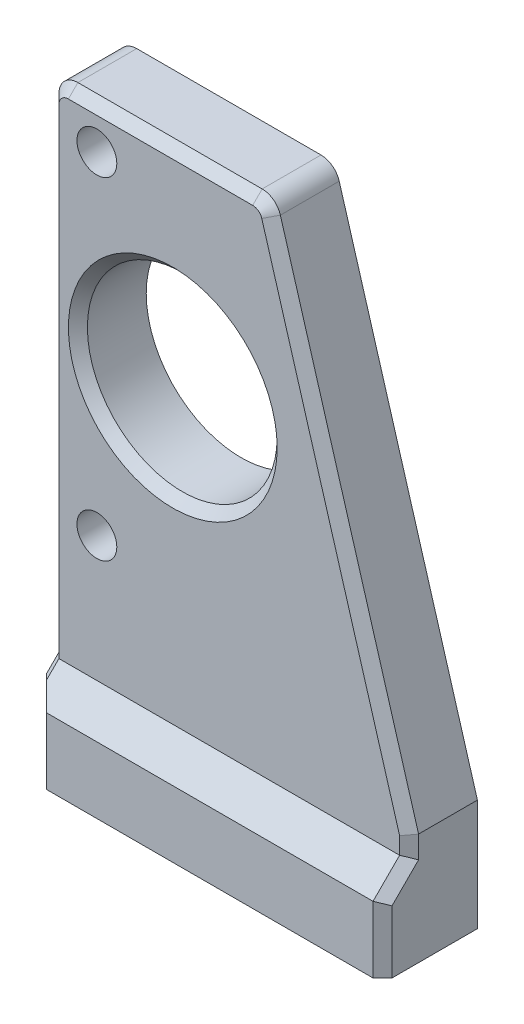
from build123d import *

# Parameters (mm, degrees)
SKIZZE1_R                            = 2.1
AUFSATZ_LINEAR_AUSTRAGEN1_DEPTH      = 10
SKIZZE2_R                            = 1.5
SCHNITT_LINEAR_AUSTRAGEN1_DEPTH      = 8
SCHNITT_LINEAR_AUSTRAGEN3_DEPTH      = 2.8
SCHNITT_LINEAR_AUSTRAGEN5_DEPTH      = 69.862823313
SCHNITT_LINEAR_AUSTRAGEN5_DEPTH_BACK = 69.862823313
SKIZZE7_R                            = 10
FASE1_SIZE                           = 3
SCHNITT_LINEAR_AUSTRAGEN4_DEPTH      = 10
VERRUNDUNG1_R                        = 2
FASE2_SIZE                           = 1
FASE3_SIZE                           = 2.5
SKIZZE8_R                            = 3.6
SCHNITT_LINEAR_AUSTRAGEN6_DEPTH      = 3


with BuildPart() as part:
    # Skizze1 → Aufsatz-Linear austragen1 (new body)
    with BuildSketch(Plane.XY):
        Polygon((28.287001282, 57.370618027), (28.287001282, 0), (-13.088781156, 0), (-13.088781156, 27.348243657), (-13.088781156, 53.715647777), (-13.088781156, 57.370618027), (-13.088781156, 62.370618027), (28.287001282, 62.370618027), align=None)
        with Locations((-8.088781156, 23.031945717)):
            Circle(SKIZZE1_R, mode=Mode.SUBTRACT)
        with Locations(Location((-8.088781156, 58.031945717, 0), (0, 0, 180))):
            Circle(SKIZZE1_R, mode=Mode.SUBTRACT)
    extrude(amount=AUFSATZ_LINEAR_AUSTRAGEN1_DEPTH)

    # Skizze2 → Schnitt-Linear austragen1 (cut)
    with BuildSketch(Plane.XZ):
        with Locations((-7, 5)):
            Circle(SKIZZE2_R)
        with Locations((6.18, 5)):
            Circle(SKIZZE2_R)
        with Locations((19.36, 5)):
            Circle(SKIZZE2_R)
    extrude(amount=-SCHNITT_LINEAR_AUSTRAGEN1_DEPTH, mode=Mode.SUBTRACT)

    # Skizze4 → Schnitt-Linear austragen3 (cut)
    with BuildSketch(Plane.XY.offset(10)):
        Polygon((-15.095168359, 10), (28.287001282, 10), (36.093332102, 46.989971623), (30.429094825, 65.957451721), (-16.081030445, 65.957451721), (-16.081030445, 27.753515123), align=None)
    extrude(amount=-SCHNITT_LINEAR_AUSTRAGEN3_DEPTH, mode=Mode.SUBTRACT)

    # Skizze7 → Schnitt-Linear austragen5 (cut, two sides: drawn at the far end of the back side and taken through both)
    with BuildSketch(Plane.XY.offset(7.2).offset(-SCHNITT_LINEAR_AUSTRAGEN5_DEPTH_BACK)):
        with Locations((-0.088781156, 40.531945717)):
            Circle(SKIZZE7_R)
    extrude(amount=SCHNITT_LINEAR_AUSTRAGEN5_DEPTH + SCHNITT_LINEAR_AUSTRAGEN5_DEPTH_BACK, mode=Mode.SUBTRACT)

    # Fase1
    # the kernel refuses this chamfer: 3 mm, written as the material it takes off along each edge
    with BuildSketch(Plane(origin=(-20.80383012, 10, 10), x_dir=(0, -0.9996219169112969, 0.027495876610586202), z_dir=(1, 0, 0))) as fase1_piece_1_section:
        Polygon((FASE1_SIZE * 0.999621916911, FASE1_SIZE * 0.0274958766106), (-FASE1_SIZE * 0.0274958766106, FASE1_SIZE * 0.999621916911), (0, 0), align=None)
    fase1_piece_1 = extrude(amount=56.805880365, mode=Mode.PRIVATE)
    fase1_piece_1 = split(fase1_piece_1, bisect_by=Plane(origin=(7.599110063, 8.999392985, 7.2), z_dir=(0, 0, 1)), keep=Keep.TOP, mode=Mode.PRIVATE)
    add(fase1_piece_1, mode=Mode.SUBTRACT)

    # Skizze5 → Schnitt-Linear austragen4 (cut)
    with BuildSketch(Plane(origin=(0, 0, 0), x_dir=(-1, 0, 0), z_dir=(0, 0, -1))):
        Polygon((-24.81273389, 11.736777957), (-9.824335871, 62.370618027), (-28.287001282, 62.370618027), (-28.287001282, 0), (-24.81273389, 0), align=None)
    extrude(amount=-SCHNITT_LINEAR_AUSTRAGEN4_DEPTH, mode=Mode.SUBTRACT)

    # Verrundung1
    verrundung1_edges = [part.edges().sort_by_distance(p)[0] for p in [
        (9.824335871, 62.370618027, 3.6),
        (-13.088781156, 62.370618027, 3.6),
    ]]
    fillet(verrundung1_edges, radius=VERRUNDUNG1_R)

    # Fase2
    fase2_edges = [part.edges().sort_by_distance(p)[0] for p in [
        (24.81273389, 10.768388979, 7.2),
        (24.81273389, 3.5, 10),
        (-13.088781156, 35.085309014, 7.2),
        (-1.379099888, 62.370618027, 7.2),
        (17.530529072, 36.337538735, 7.2),
        (9.527376482, 61.973016693, 7.2),
        (-12.502994718, 61.78483159, 7.2),
        (-10.088781156, 40.531945717, 7.2),
        (-13.088781156, 8.4, 8.6),
        (24.81273389, 8.4, 8.6),
    ]]
    chamfer(fase2_edges, length=FASE2_SIZE)

    # Fase3
    fase3_edges = [part.edges().sort_by_distance(p)[0] for p in [
        (-13.088781156, 2.792893219, 10),
    ]]
    chamfer(fase3_edges, length=FASE3_SIZE)

    # Skizze8 → Schnitt-Linear austragen6 (cut)
    with BuildSketch(Plane(origin=(0, 0, 0), x_dir=(-1, 0, 0), z_dir=(0, 0, -1))):
        with Locations((8.088781156, 23.031945717)):
            Circle(SKIZZE8_R)
    extrude(amount=-SCHNITT_LINEAR_AUSTRAGEN6_DEPTH, mode=Mode.SUBTRACT)


solid = part.part
